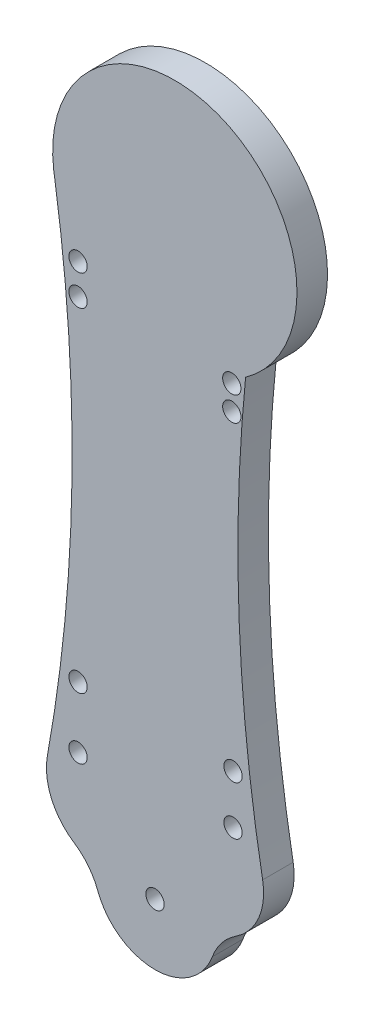
from build123d import *

# Parameters (mm, degrees)
RESSALTO_EXTRUS_O1_DEPTH = 5
FILETE3_R                = 10
FILETE4_R                = 10
ESBO_O2_R                = 1.5
CORTE_EXTRUS_O1_DEPTH    = 5
ESBO_O3_R                = 1.5
CORTE_EXTRUS_O2_DEPTH    = 121.092170275
ESBO_O4_R                = 1.5
CORTE_EXTRUS_O3_DEPTH    = 10


with BuildPart() as part:
    # Esboço1 → Ressalto-extrusão1 (new body)
    with BuildSketch(Plane.XY):
        with BuildLine():
            ThreePointArc((-10, 0), (0, -10), (10, 0))
            Line((10, 0), (20, 0))
            ThreePointArc((20, 0), (14.071698091, 40.495175194), (14.829943665, 81.414963086))
            ThreePointArc((14.829943665, 81.414963086), (11.193742071, 116.066691762), (-16.576524471, 95.024435265))
            Line((-16.576524471, 95.024435265), (-16.487894969, 94.437265709))
            Line((-16.487894969, 94.437265709), (-16.369382775, 93.652123615))
            ThreePointArc((-16.369382775, 93.652123615), (-13.756795166, 46.654405302), (-20, 0))
            Line((-20, 0), (-10, 0))
        make_face()
    extrude(amount=RESSALTO_EXTRUS_O1_DEPTH)

    # Filete3
    # the kernel refuses this fillet: 10 mm, written as the material it takes off along each edge
    with BuildSketch(Plane(origin=(20, 0, -29.463728433), x_dir=(-0.20232831186330175, 0.9793177493635794, 0), z_dir=(0, 0, 1))) as filete3_piece_1:
        with BuildLine():
            CenterArc((12.021201201, 9.997221658), FILETE3_R, 181.169168083, 87.480189)
            Line((2.023283119, 9.793177494), (1.823324757, 9.78909661))
            ThreePointArc((1.823324757, 9.78909661), (0.815778009, 4.937054409), (-0.19586355, 0.040465662))
            Line((-0.19586355, 0.040465662), (0.004714197, -0.199944433))
            ThreePointArc((0.004714197, -0.199944433), (5.892745687, -0.130541448), (11.780777177, -0.199944433))
            Line((11.780777177, -0.199944433), (11.785491373, 0))
        make_face()
    extrude(amount=63.927456867, mode=Mode.SUBTRACT)
    with BuildSketch(Plane(origin=(-20, 0, -29.463728433), x_dir=(1, 0, 0), z_dir=(0, 0, 1))) as filete3_piece_2:
        with BuildLine():
            CenterArc((12.222685959, 9.749854723), FILETE3_R, 169.67749742, 87.480189)
            Line((2.384538574, 11.541740887), (2.187775626, 11.57757861))
            ThreePointArc((2.187775626, 11.57757861), (1.06442773, 5.797282674), (-0.194855317, 0.045071116))
            Line((-0.194855317, 0.045071116), (0, -0.2))
            ThreePointArc((0, -0.2), (5, -0.2), (9.955546281, -0.194997094))
            Line((9.955546281, -0.194997094), (10, 0))
        make_face()
    extrude(amount=63.927456867, mode=Mode.SUBTRACT)

    # Filete4
    filete4_edges = [part.edges().sort_by_distance(p)[0] for p in [
        (10, 0, 2.5),
        (-10, 0, 2.5),
    ]]
    fillet(filete4_edges, radius=FILETE4_R)

    # Esboço2 → Corte-extrusão1 (cut)
    with BuildSketch(Plane.XY.offset(5)):
        Circle(ESBO_O2_R)
    extrude(amount=-CORTE_EXTRUS_O1_DEPTH, mode=Mode.SUBTRACT)

    # Esboço3 → Corte-extrusão2 (cut, through all)
    with BuildSketch(Plane.XY.offset(5)):
        with Locations((-12.6, 14.5)):
            Circle(ESBO_O3_R)
        with Locations((-12.6, 24.5)):
            Circle(ESBO_O3_R)
        with Locations((-12.6, 79.11)):
            Circle(ESBO_O3_R)
        with Locations((-12.6, 84.11)):
            Circle(ESBO_O3_R)
    extrude(amount=-CORTE_EXTRUS_O2_DEPTH, mode=Mode.SUBTRACT)

    # Esboço4 → Corte-extrusão3 (cut)
    with BuildSketch(Plane.XY.offset(5)):
        with Locations((12.57, 79.41)):
            Circle(ESBO_O4_R)
        with Locations((12.57, 75.41)):
            Circle(ESBO_O4_R)
        with Locations((12.77, 24.54)):
            Circle(ESBO_O4_R)
        with Locations((12.77, 16.54)):
            Circle(ESBO_O4_R)
    extrude(amount=-CORTE_EXTRUS_O3_DEPTH, mode=Mode.SUBTRACT)


solid = part.part
